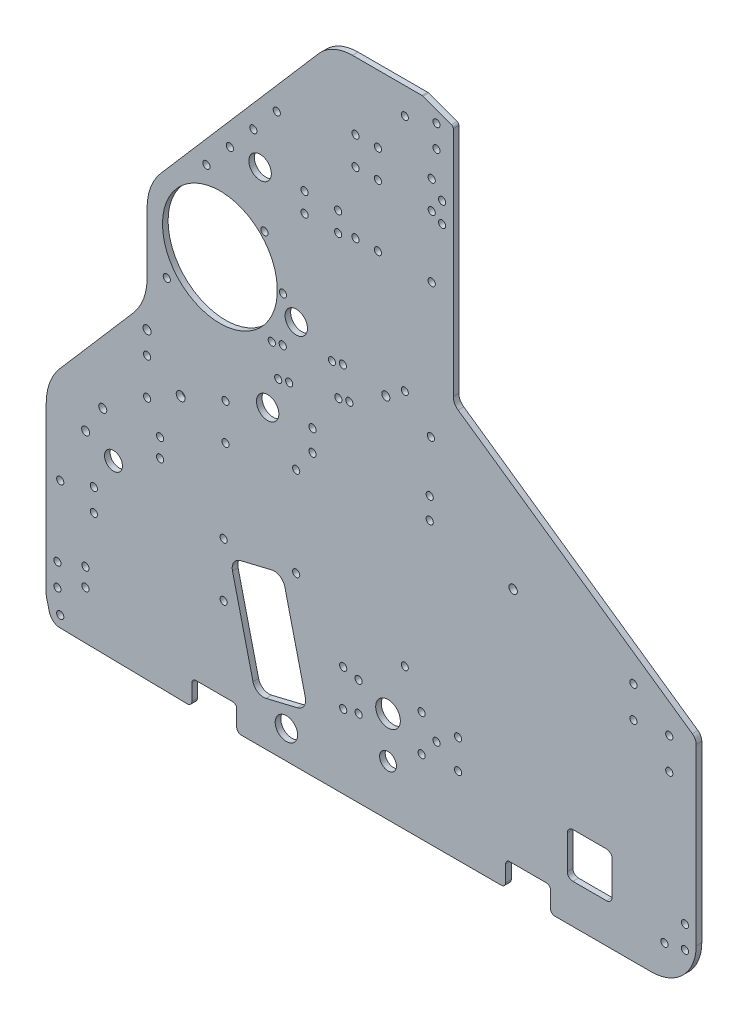
from build123d import *

# Parameters (mm, degrees)
SKETCH1_R           = 2.032
SKETCH1_R_2         = 5.08
SKETCH1_R_3         = 2.54
SKETCH1_R_4         = 6.35
SKETCH1_R_5         = 2
BOSS_EXTRUDE1_DEPTH = 3.175
FILLET1_R           = 2.286
FILLET2_R           = 6.35
SKETCH2_R           = 2.032
CUT_EXTRUDE1_DEPTH  = 505.524983177
FILLET3_R           = 1.5875
SKETCH3_R           = 6.35
SKETCH3_R_2         = 2.032
SKETCH3_R_3         = 2.286
CUT_EXTRUDE2_DEPTH  = 505.524983177
SKETCH4_R           = 2.032
SKETCH4_R_2         = 6.985
SKETCH4_R_3         = 4.7625
CUT_EXTRUDE3_DEPTH  = 505.524983177
SKETCH5_R           = 32.54375
SKETCH5_R_2         = 6.35
SKETCH5_R_3         = 2.39
CUT_EXTRUDE5_DEPTH  = 505.524983177
FILLET4_R           = 31.75
CUT_EXTRUDE6_DEPTH  = 505.524983177
FILLET5_R           = 25.4
SKETCH8_R           = 2.032000002
SKETCH8_R_2         = 2.031999999
SKETCH8_R_3         = 2.031999998
CUT_EXTRUDE7_DEPTH  = 505.524983177
SKETCH10_R          = 2.032
CUT_EXTRUDE8_DEPTH  = 505.524983177
SKETCH11_RX         = 2.032
SKETCH11_RY         = 2.031999502
CUT_EXTRUDE9_DEPTH  = 505.524983177
SKETCH12_R          = 2.032
CUT_EXTRUDE10_DEPTH = 505.524983319
SKETCH14_R          = 6.375981846
CUT_EXTRUDE11_DEPTH = 505.524983319
SKETCH15_R          = 2.286
SKETCH15_R_2        = 2.159
CUT_EXTRUDE12_DEPTH = 505.524983319
FILLET7_R           = 5.08
FILLET8_R           = 2.54
SKETCH17_R          = 2.032
CUT_EXTRUDE13_DEPTH = 505.524983319
FILLET9_R           = 25.4


with BuildPart() as part:
    # Sketch1 → Boss-Extrude1 (new body)
    with BuildSketch(Plane.XY):
        with BuildLine():
            Line((7.829508682, -19.049081656), (82.55, -20.32))
            Line((82.55, -20.32), (82.55, -6.35))
            Line((82.55, -6.35), (107.95, -6.35))
            Line((107.95, -6.35), (107.95, -20.32))
            Line((107.95, -20.32), (260.35, -20.32))
            Line((260.35, -20.32), (260.35, -6.35))
            Line((260.35, -6.35), (285.75, -6.35))
            Line((285.75, -6.35), (285.75, -20.32))
            Line((285.75, -20.32), (368.3, -20.32))
            Line((368.3, -20.32), (368.3, 106.68))
            Line((368.3, 106.68), (230.66375, 202.565))
            Line((230.66375, 202.565), (230.66375, 338.455))
            Line((230.66375, 338.455), (213.19998, 344.805))
            Line((213.19998, 344.805), (203.2, 344.805))
            Line((203.2, 344.805), (161.925, 344.805))
            Line((161.925, 344.805), (52.720122664, 218.469945827))
            ThreePointArc((52.720122664, 218.469945827), (52.803835479, 218.142145922), (52.832, 217.805))
            ThreePointArc((52.832, 217.805), (52.095493096, 216.239521914), (50.419872403, 215.808871996))
            Line((50.419872403, 215.808871996), (0, 157.48))
            Line((0, 157.48), (0, 0))
            Line((0, 0), (0, -6.35))
            ThreePointArc((0, -6.35), (0.047577015, -7.125863724), (0.189595124, -7.890101219))
            Line((0.189595124, -7.890101219), (1.777095124, -14.240101219))
            ThreePointArc((1.777095124, -14.240101219), (3.987212552, -17.671692778), (7.829508682, -19.049081656))
        make_face()
        with Locations((7.9375, -12.7)):
            Circle(SKETCH1_R, mode=Mode.SUBTRACT)
        with Locations((6.35, 0)):
            Circle(SKETCH1_R, mode=Mode.SUBTRACT)
        with Locations((6.35, 12.7)):
            Circle(SKETCH1_R, mode=Mode.SUBTRACT)
        with Locations((38.1, 78.105)):
            Circle(SKETCH1_R_2, mode=Mode.SUBTRACT)
        with Locations((57.15, 118.58625)):
            Circle(SKETCH1_R, mode=Mode.SUBTRACT)
        with Locations((57.15, 139.22375)):
            Circle(SKETCH1_R, mode=Mode.SUBTRACT)
        with Locations((76.2, 128.905)):
            Circle(SKETCH1_R_3, mode=Mode.SUBTRACT)
        with Locations((101.6, 118.58625)):
            Circle(SKETCH1_R, mode=Mode.SUBTRACT)
        with Locations((101.6, 139.22375)):
            Circle(SKETCH1_R, mode=Mode.SUBTRACT)
        with Locations((125.468192568, 147.91106164)):
            Circle(SKETCH1_R_4, mode=Mode.SUBTRACT)
        with Locations((203.2, 59.805)):
            Circle(SKETCH1_R_5, mode=Mode.SUBTRACT)
        with Locations((350.339487758, -2.359487758)):
            Circle(SKETCH1_R, mode=Mode.SUBTRACT)
        with Locations((361.95, 0)):
            Circle(SKETCH1_R, mode=Mode.SUBTRACT)
        with Locations((361.95, 12.7)):
            Circle(SKETCH1_R, mode=Mode.SUBTRACT)
        with Locations((353.06, 82.955052336)):
            Circle(SKETCH1_R, mode=Mode.SUBTRACT)
        with Locations((332.74, 98.195052336)):
            Circle(SKETCH1_R, mode=Mode.SUBTRACT)
        with Locations((332.74, 115.975052336)):
            Circle(SKETCH1_R, mode=Mode.SUBTRACT)
        with Locations((353.06, 100.735052336)):
            Circle(SKETCH1_R, mode=Mode.SUBTRACT)
        with Locations((68.326, 182.923674932)):
            Circle(SKETCH1_R, mode=Mode.SUBTRACT)
        with Locations((76.2, 217.805)):
            Circle(SKETCH1_R, mode=Mode.SUBTRACT)
        with Locations((90.779500502, 249.682)):
            Circle(SKETCH1_R, mode=Mode.SUBTRACT)
        with Locations((104.067838673, 265.054783374)):
            Circle(SKETCH1_R, mode=Mode.SUBTRACT)
        with Locations((117.356176844, 280.427566748)):
            Circle(SKETCH1_R, mode=Mode.SUBTRACT)
        with Locations((130.644515014, 295.800350122)):
            Circle(SKETCH1_R, mode=Mode.SUBTRACT)
        with Locations((203.2, 194.805)):
            Circle(SKETCH1_R_5, mode=Mode.SUBTRACT)
        with Locations((224.31375, 287.401)):
            Circle(SKETCH1_R, mode=Mode.SUBTRACT)
        with Locations((224.31375, 298.831)):
            Circle(SKETCH1_R, mode=Mode.SUBTRACT)
        with Locations((203.2, 329.805)):
            Circle(SKETCH1_R_5, mode=Mode.SUBTRACT)
        with Locations((221.138115, 322.58)):
            Circle(SKETCH1_R_5, mode=Mode.SUBTRACT)
        with Locations((221.138115, 335.28)):
            Circle(SKETCH1_R_5, mode=Mode.SUBTRACT)
    extrude(amount=BOSS_EXTRUDE1_DEPTH)

    # Fillet1
    fillet1_edges = [part.edges().sort_by_distance(p)[0] for p in [
        (285.75, -6.35, 1.5875),
        (107.95, -6.35, 1.5875),
        (260.35, -6.35, 1.5875),
        (82.55, -6.35, 1.5875),
    ]]
    fillet(fillet1_edges, radius=FILLET1_R)

    # Fillet2
    fillet2_edges = [part.edges().sort_by_distance(p)[0] for p in [
        (230.66375, 202.565, 1.5875),
    ]]
    fillet(fillet2_edges, radius=FILLET2_R)

    # Sketch2 → Cut-Extrude1 (cut, through all)
    with BuildSketch(Plane(origin=(0, 0, 0), x_dir=(-1, 0, 0), z_dir=(0, 0, -1))):
        with Locations((-100.552770272, 71.086035298)):
            Circle(SKETCH2_R)
        with Locations((-100.552770272, 40.606035298)):
            Circle(SKETCH2_R)
        with Locations((-22.225, 18.202541089)):
            Circle(SKETCH2_R)
        with Locations((-22.225, 8.042541089)):
            Circle(SKETCH2_R)
    extrude(amount=-CUT_EXTRUDE1_DEPTH, mode=Mode.SUBTRACT)

    # Fillet3
    fillet3_edges = [part.edges().sort_by_distance(p)[0] for p in [
        (230.66375, 338.455, 1.5875),
        (213.19998, 344.805, 1.5875),
    ]]
    fillet(fillet3_edges, radius=FILLET3_R)

    # Sketch3 → Cut-Extrude2 (cut, through all)
    with BuildSketch(Plane.XY.offset(3.175)):
        with BuildLine():
            Line((127.789350211, 69.359774106), (110.090750339, 65.117184968))
            ThreePointArc((110.090750339, 65.117184968), (106.287939856, 62.356288953), (105.55119507, 57.715047577))
            Line((105.55119507, 57.715047577), (117.160037875, 9.287010566))
            ThreePointArc((117.160037875, 9.287010566), (119.92093389, 5.484200083), (124.562175266, 4.747455297))
            Line((124.562175266, 4.747455297), (142.260775137, 8.990044434))
            ThreePointArc((142.260775137, 8.990044434), (146.063585621, 11.75094045), (146.800330407, 16.392181825))
            Line((146.800330407, 16.392181825), (135.191487602, 64.820218836))
            ThreePointArc((135.191487602, 64.820218836), (132.430591586, 68.62302932), (127.789350211, 69.359774106))
        make_face()
        with Locations((136.094563167, -4.324155877)):
            Circle(SKETCH3_R)
        with Locations((26.987500002, 46.953113935)):
            Circle(SKETCH3_R_2)
        with Locations((26.987500002, 59.653113935)):
            Circle(SKETCH3_R_2)
        with Locations((7.937500002, 53.303113935)):
            Circle(SKETCH3_R_2)
        with Locations((32.030600949, 100.810868853)):
            Circle(SKETCH3_R_3)
        with Locations((64.525942114, 102.94048958)):
            Circle(SKETCH3_R_2)
        with Locations((64.525942114, 92.525786339)):
            Circle(SKETCH3_R_2)
        with Locations((134.14375, 208.228121768)):
            Circle(SKETCH3_R_2)
        with Locations((123.681970341, 233.485092108)):
            Circle(SKETCH3_R_2)
    extrude(amount=-CUT_EXTRUDE2_DEPTH, mode=Mode.SUBTRACT)

    # Sketch4 → Cut-Extrude3 (cut, through all)
    with BuildSketch(Plane.XY.offset(3.175)):
        with Locations((168.275, 42.06875)):
            Circle(SKETCH4_R)
        with Locations((212.725, 42.06875)):
            Circle(SKETCH4_R)
        with Locations((212.725, 21.43125)):
            Circle(SKETCH4_R)
        with Locations((168.275, 21.43125)):
            Circle(SKETCH4_R)
        with Locations((193.675, 31.75)):
            Circle(SKETCH4_R_2)
        with Locations((177.00498, 40.0431)):
            Circle(SKETCH4_R)
        with Locations((177.00498, 23.4569)):
            Circle(SKETCH4_R)
        with Locations((193.675, 8.466666658)):
            Circle(SKETCH4_R_3)
        with Locations((221.138115, 31.75)):
            Circle(SKETCH4_R)
        with Locations((233.36123, 23.4569)):
            Circle(SKETCH4_R)
        with Locations((233.36123, 40.0431)):
            Circle(SKETCH4_R)
    extrude(amount=-CUT_EXTRUDE3_DEPTH, mode=Mode.SUBTRACT)

    # Sketch5 → Cut-Extrude5 (cut, through all)
    with BuildSketch(Plane(origin=(0, 0, 0), x_dir=(-1, 0, 0), z_dir=(0, 0, -1))):
        Polygon((0, 157.48), (-57.15, 223.594705882), (-57.15, 165.333696112), (0, 99.218990229), align=None)
        with Locations((-98.425, 208.228121768)):
            Circle(SKETCH5_R)
        with Locations((-141.675587431, 197.971943782)):
            Circle(SKETCH5_R_2)
        with Locations((-264.573581764, 128.332790468)):
            Circle(SKETCH5_R_3)
    extrude(amount=-CUT_EXTRUDE5_DEPTH, mode=Mode.SUBTRACT)

    # Fillet4
    fillet4_edges = [part.edges().sort_by_distance(p)[0] for p in [
        (0, 99.218990229, 1.5875),
        (57.15, 165.333696112, 1.5875),
        (57.15, 223.594705882, 1.5875),
    ]]
    fillet(fillet4_edges, radius=FILLET4_R)

    # Sketch6 → Cut-Extrude6 (cut, through all)
    with BuildSketch(Plane.XY.offset(3.175)):
        with BuildLine():
            Line((298.45, 27.305), (317.5, 27.305))
            ThreePointArc((317.5, 27.305), (319.74506403, 26.37506403), (320.675, 24.13))
            Line((320.675, 24.13), (320.675, 5.08))
            ThreePointArc((320.675, 5.08), (319.74506403, 2.83493597), (317.5, 1.905))
            Line((317.5, 1.905), (298.45, 1.905))
            ThreePointArc((298.45, 1.905), (296.20493597, 2.83493597), (295.275, 5.08))
            Line((295.275, 5.08), (295.275, 24.13))
            ThreePointArc((295.275, 24.13), (296.20493597, 26.37506403), (298.45, 27.305))
        make_face()
    extrude(amount=-CUT_EXTRUDE6_DEPTH, mode=Mode.SUBTRACT)

    # Fillet5
    fillet5_edges = [part.edges().sort_by_distance(p)[0] for p in [
        (161.925, 344.805, 1.5875),
    ]]
    fillet(fillet5_edges, radius=FILLET5_R)

    # Sketch8 → Cut-Extrude7 (cut, through all)
    with BuildSketch(Plane(origin=(0, 0, 0), x_dir=(-1, 0, 0), z_dir=(0, 0, -1))):
        with Locations((-218.44, 290.83)):
            Circle(SKETCH8_R)
        with Locations((-187.96, 290.83)):
            Circle(SKETCH8_R)
        with Locations((-187.96, 306.70500001)):
            Circle(SKETCH8_R_2)
        with Locations((-175.26, 290.83)):
            Circle(SKETCH8_R)
        with Locations((-187.96, 255.905)):
            Circle(SKETCH8_R)
        with Locations((-218.44, 306.70500001)):
            Circle(SKETCH8_R_3)
        with Locations((-175.26, 306.70500001)):
            Circle(SKETCH8_R_2)
        with Locations((-175.26, 255.905)):
            Circle(SKETCH8_R)
        with Locations((-218.44, 255.905)):
            Circle(SKETCH8_R)
    extrude(amount=-CUT_EXTRUDE7_DEPTH, mode=Mode.SUBTRACT)

    # Sketch10 → Cut-Extrude8 (cut, through all)
    with BuildSketch(Plane.XY.offset(3.175)):
        with Locations((141.64248, 74.684371768)):
            Circle(SKETCH10_R)
        with Locations((141.64248, 125.484371768)):
            Circle(SKETCH10_R)
    extrude(amount=-CUT_EXTRUDE8_DEPTH, mode=Mode.SUBTRACT)

    # Sketch11 → Cut-Extrude9 (cut, through all)
    with BuildSketch(Plane.XY.offset(3.175)):
        with Locations(Location((150.881424454, 138.43), (0, 0, 90))):
            Ellipse(SKETCH11_RX, SKETCH11_RY)
        with Locations(Location((150.881424454, 150.495), (0, 0, 90))):
            Ellipse(SKETCH11_RX, SKETCH11_RY)
        with Locations(Location((217.30240818, 150.495), (0, 0, 90))):
            Ellipse(SKETCH11_RX, SKETCH11_RY)
        with Locations(Location((217.30240818, 138.43), (0, 0, 90))):
            Ellipse(SKETCH11_RX, SKETCH11_RY)
    extrude(amount=-CUT_EXTRUDE9_DEPTH, mode=Mode.SUBTRACT)

    # Sketch12 → Cut-Extrude10 (cut, through all)
    with BuildSketch(Plane(origin=(0, 0, 0), x_dir=(-1, 0, 0), z_dir=(0, 0, -1))):
        with Locations((-165.4175, 264.63498)):
            Circle(SKETCH12_R)
        with Locations((-165.4175, 253.52248)):
            Circle(SKETCH12_R)
        with Locations((-146.3675, 253.52248)):
            Circle(SKETCH12_R)
        with Locations((-146.3675, 264.63498)):
            Circle(SKETCH12_R)
    extrude(amount=-CUT_EXTRUDE10_DEPTH, mode=Mode.SUBTRACT)

    # Sketch14 → Cut-Extrude11 (cut, through all)
    with BuildSketch(Plane(origin=(0, 0, 0), x_dir=(-1, 0, 0), z_dir=(0, 0, -1))):
        with Locations((-121.184716432, 263.688494682)):
            Circle(SKETCH14_R)
    extrude(amount=-CUT_EXTRUDE11_DEPTH, mode=Mode.SUBTRACT)

    # Sketch15 → Cut-Extrude12 (cut, through all)
    with BuildSketch(Plane.XY.offset(3.175)):
        with Locations((57.15, 151.92375)):
            Circle(SKETCH15_R)
        with Locations((192.439038956, 187.119947783)):
            Circle(SKETCH15_R)
        with Locations((38.1, 78.105)):
            Circle(SKETCH15_R_2)
        with Locations((22.359447527, 84.872674248)):
            Circle(SKETCH15_R)
        with BuildLine():
            ThreePointArc((163.873739892, 173.680575348), (163.573171662, 172.102507308), (164.512499361, 170.799317578))
            ThreePointArc((164.512499361, 170.799317578), (167.540838635, 172.982117899), (163.873739892, 173.680575348))
        make_face()
        with BuildLine():
            ThreePointArc((173.43975005, 172.778441407), (173.74031828, 174.356509448), (172.800990581, 175.659699178))
            ThreePointArc((172.800990581, 175.659699178), (169.772651307, 173.476898857), (173.43975005, 172.778441407))
        make_face()
        with BuildLine():
            ThreePointArc((169.158852977, 192.088320238), (166.130513703, 189.905519916), (169.797612447, 189.207062467))
            ThreePointArc((169.797612447, 189.207062467), (170.098180676, 190.785130507), (169.158852977, 192.088320238))
        make_face()
        with BuildLine():
            ThreePointArc((160.231602288, 190.109196408), (159.931034058, 188.531128368), (160.870361757, 187.227938637))
            ThreePointArc((160.870361757, 187.227938637), (163.898701031, 189.410738959), (160.231602288, 190.109196408))
        make_face()
        with BuildLine():
            ThreePointArc((129.776601843, 166.121421831), (129.476033613, 164.543353791), (130.415361312, 163.240164061))
            ThreePointArc((130.415361312, 163.240164061), (133.443700586, 165.422964382), (129.776601843, 166.121421831))
        make_face()
        with BuildLine():
            ThreePointArc((139.342612001, 165.219287891), (139.643180231, 166.797355931), (138.703852532, 168.100545661))
            ThreePointArc((138.703852532, 168.100545661), (135.675513258, 165.91774534), (139.342612001, 165.219287891))
        make_face()
        with BuildLine():
            ThreePointArc((135.700474398, 181.647908951), (136.001042628, 183.225976991), (135.061714928, 184.529166721))
            ThreePointArc((135.061714928, 184.529166721), (132.033375655, 182.3463664), (135.700474398, 181.647908951))
        make_face()
        with BuildLine():
            ThreePointArc((126.134464239, 182.550042891), (125.83389601, 180.971974851), (126.773223709, 179.668785121))
            ThreePointArc((126.773223709, 179.668785121), (129.801562982, 181.851585442), (126.134464239, 182.550042891))
        make_face()
    extrude(amount=-CUT_EXTRUDE12_DEPTH, mode=Mode.SUBTRACT)

    # Fillet7
    fillet7_edges = [part.edges().sort_by_distance(p)[0] for p in [
        (368.3, 106.68, 1.5875),
    ]]
    fillet(fillet7_edges, radius=FILLET7_R)

    # Fillet8
    fillet8_edges = [part.edges().sort_by_distance(p)[0] for p in [
        (82.55, -20.32, 1.5875),
        (107.95, -20.32, 1.5875),
        (260.35, -20.32, 1.5875),
        (285.75, -20.32, 1.5875),
    ]]
    fillet(fillet8_edges, radius=FILLET8_R)

    # Sketch17 → Cut-Extrude13 (cut, through all)
    with BuildSketch(Plane.XY.offset(3.175)):
        with Locations((217.96375, 179.705)):
            Circle(SKETCH17_R)
    extrude(amount=-CUT_EXTRUDE13_DEPTH, mode=Mode.SUBTRACT)

    # Fillet9
    fillet9_edges = [part.edges().sort_by_distance(p)[0] for p in [
        (368.3, -20.32, 1.5875),
    ]]
    fillet(fillet9_edges, radius=FILLET9_R)


solid = part.part
